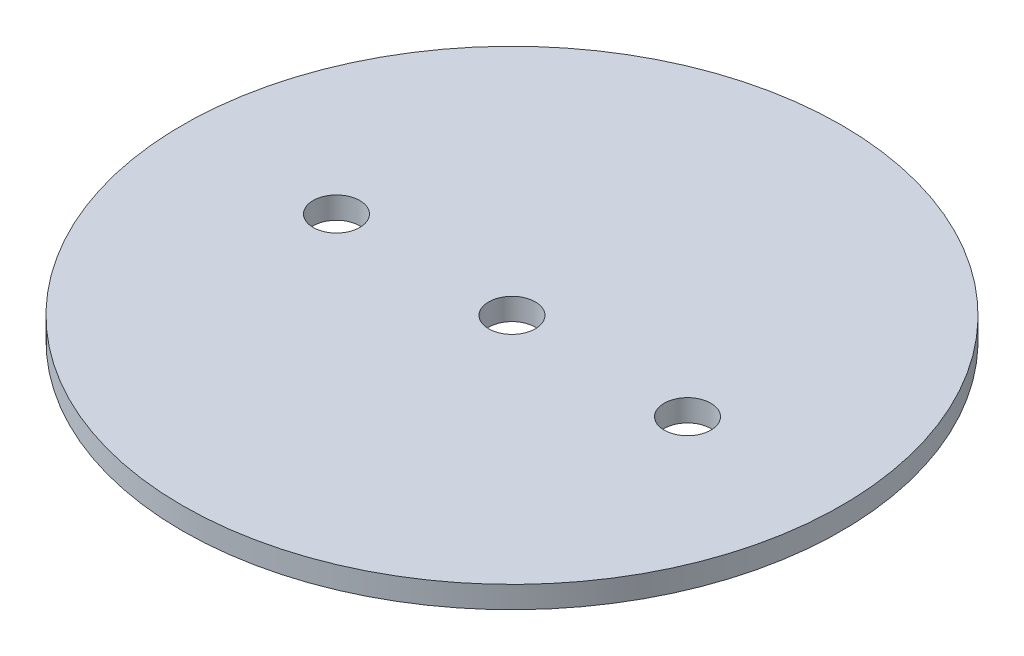
from build123d import *

# Parameters (mm, degrees)
SKETCH1_R                       = 47.6885
BOSS_EXTRUDE1_DEPTH             = 3.175
F_1_4_CLEARANCE_HOLE1_OUTLINE_R = 3.3782
F_1_4_CLEARANCE_HOLE1_DEPTH     = 3.175


# Read off the part's stored shape, not the designer's step: 1/4 Clearance Hole1
with BuildPart() as part:
    # Sketch1 → Boss-Extrude1 (new body)
    with BuildSketch(Plane(origin=(0, 0, 0), x_dir=(1, 0, 0), z_dir=(0, 1, 0))):
        with Locations(Location((0, 0, 0), (0, 0, 270))):
            Circle(SKETCH1_R)
    extrude(amount=BOSS_EXTRUDE1_DEPTH)

    # 1/4 Clearance Hole1 outline → 1/4 Clearance Hole1 (cut)
    with BuildSketch(Plane(origin=(0, 0, 0), x_dir=(1, 0, 0), z_dir=(0, 1, 0))):
        Circle(F_1_4_CLEARANCE_HOLE1_OUTLINE_R)
        with Locations((25.4, 0)):
            Circle(F_1_4_CLEARANCE_HOLE1_OUTLINE_R)
        with Locations((-25.4, 0)):
            Circle(F_1_4_CLEARANCE_HOLE1_OUTLINE_R)
    extrude(amount=F_1_4_CLEARANCE_HOLE1_DEPTH, mode=Mode.SUBTRACT)


solid = part.part
